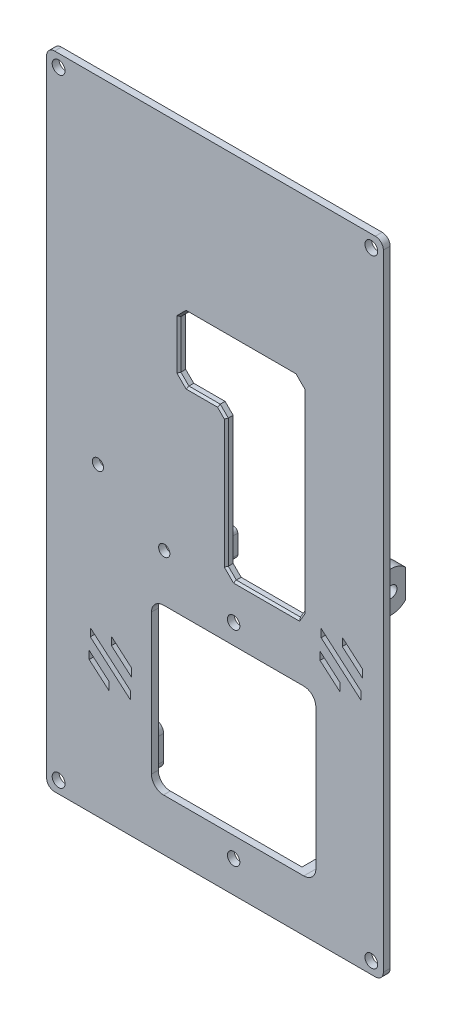
from build123d import *

# Parameters (mm, degrees)
SKETCH_1_R          = 1.6
EXTRUDE_2_DEPTH     = 1.7
EXTRUDE_3_DEPTH     = 1.7
EXTRUDE_4_DEPTH     = 1.7
EXTRUDE_5_DEPTH     = 5.5
SKETCH_7_W          = 10.585667863
SKETCH_7_H          = 36.726600393
EXTRUDE_7_DEPTH     = 1.7
CHAMFER_1_SIZE      = 2
SKETCH_8_R          = 1.4
CUT_EXTRUDE_2_DEPTH = 1.7
EXTRUDE_8_DEPTH     = 2
CUT_EXTRUDE_3_DEPTH = 1.7
SKETCH_11_R         = 1.4
EXTRUDE_9_DEPTH     = 6.5
FILLET_1_R          = 2
SKETCH_12_W         = 3.2
SKETCH_12_H         = 56.377024887
CUT_EXTRUDE_4_DEPTH = 10
FILLET_2_R          = 2
SKETCH_13_R         = 1.55
CUT_EXTRUDE_5_DEPTH = 10
FILLET_3_R          = 3
CUT_EXTRUDE_6_DEPTH = 1.7
EXTRUDE_10_DEPTH    = 1.7
CUT_EXTRUDE_7_DEPTH = 10
CHAMFER_2_SIZE      = 0.5
EXTRUDE_START       = -1.7
SKETCH_17_R         = 1.6
EXTRUDE_11_DEPTH    = 1.7
SKETCH_18_W         = 76
SKETCH_18_H         = 26.241599538
SKETCH_18_H_2       = 29.427514862
CUT_EXTRUDE_8_DEPTH = 1.7
EXTRUDE_12_DEPTH    = 1.7
SKETCH_20_R         = 1.6
CUT_EXTRUDE_9_DEPTH = 1.7
FILLET_4_R          = 2


with BuildPart() as part:
    # 草图1 → 凸台-拉伸2 (new body)
    with BuildSketch(Plane.XY):
        with BuildLine():
            Line((-237.109838541, 1489.364517141), (-241.33992148, 1480.904351264))
            ThreePointArc((-241.33992148, 1480.904351264), (-241.6014133, 1480.507591558), (-241.949123299, 1480.183718137))
            Line((-241.949123299, 1480.183718137), (-254.721014879, 1470.855029631))
            ThreePointArc((-254.721014879, 1470.855029631), (-255.280232366, 1470.568758753), (-255.900667441, 1470.47008995))
            Line((-255.900667441, 1470.47008995), (-262.702950171, 1470.47008995))
            ThreePointArc((-262.702950171, 1470.47008995), (-265.531377295, 1469.298517074), (-266.702950171, 1466.47008995))
            Line((-266.702950171, 1466.47008995), (-266.702950171, 1318.47008995))
            ThreePointArc((-266.702950171, 1318.47008995), (-265.531377295, 1315.641662825), (-262.702950171, 1314.47008995))
            Line((-262.702950171, 1314.47008995), (-255.900667441, 1314.47008995))
            ThreePointArc((-255.900667441, 1314.47008995), (-255.280232366, 1314.371421146), (-254.721014879, 1314.085150268))
            Line((-254.721014879, 1314.085150268), (-241.949123299, 1304.756461763))
            ThreePointArc((-241.949123299, 1304.756461763), (-241.6014133, 1304.432588342), (-241.33992148, 1304.035828635))
            Line((-241.33992148, 1304.035828635), (-237.109838541, 1295.575662759))
            ThreePointArc((-237.109838541, 1295.575662759), (-236.372446384, 1294.768788333), (-235.320984159, 1294.47008995))
            Line((-235.320984159, 1294.47008995), (-214.084916182, 1294.47008995))
            ThreePointArc((-214.084916182, 1294.47008995), (-213.033453958, 1294.768788333), (-212.2960618, 1295.575662759))
            Line((-212.2960618, 1295.575662759), (-208.065978862, 1304.035828635))
            ThreePointArc((-208.065978862, 1304.035828635), (-207.804487042, 1304.432588342), (-207.456777042, 1304.756461763))
            Line((-207.456777042, 1304.756461763), (-194.684885463, 1314.085150268))
            ThreePointArc((-194.684885463, 1314.085150268), (-194.125667975, 1314.371421146), (-193.5052329, 1314.47008995))
            Line((-193.5052329, 1314.47008995), (-186.702950171, 1314.47008995))
            ThreePointArc((-186.702950171, 1314.47008995), (-183.874523046, 1315.641662825), (-182.702950171, 1318.47008995))
            Line((-182.702950171, 1318.47008995), (-182.702950171, 1466.47008995))
            ThreePointArc((-182.702950171, 1466.47008995), (-183.874523046, 1469.298517074), (-186.702950171, 1470.47008995))
            Line((-186.702950171, 1470.47008995), (-193.5052329, 1470.47008995))
            ThreePointArc((-193.5052329, 1470.47008995), (-194.125667975, 1470.568758753), (-194.684885463, 1470.855029631))
            Line((-194.684885463, 1470.855029631), (-207.456777042, 1480.183718137))
            ThreePointArc((-207.456777042, 1480.183718137), (-207.804487042, 1480.507591558), (-208.065978862, 1480.904351264))
            Line((-208.065978862, 1480.904351264), (-212.2960618, 1489.364517141))
            ThreePointArc((-212.2960618, 1489.364517141), (-213.033453958, 1490.171391566), (-214.084916182, 1490.47008995))
            Line((-214.084916182, 1490.47008995), (-235.320984159, 1490.47008995))
            ThreePointArc((-235.320984159, 1490.47008995), (-236.372446384, 1490.171391566), (-237.109838541, 1489.364517141))
        make_face()
        with Locations((-201.702950171, 1470.97008995)):
            Circle(SKETCH_1_R, mode=Mode.SUBTRACT)
        with Locations((-247.702950171, 1470.97008995)):
            Circle(SKETCH_1_R, mode=Mode.SUBTRACT)
        with Locations((-247.702950171, 1313.97008995)):
            Circle(SKETCH_1_R, mode=Mode.SUBTRACT)
        with Locations((-201.702950171, 1313.97008995)):
            Circle(SKETCH_1_R, mode=Mode.SUBTRACT)
        with BuildLine():
            Line((-203.466882193, 1467.47008995), (-189.702950171, 1467.47008995))
            ThreePointArc((-189.702950171, 1467.47008995), (-186.874523046, 1466.298517074), (-185.702950171, 1463.47008995))
            Line((-185.702950171, 1463.47008995), (-185.702950171, 1321.47008995))
            ThreePointArc((-185.702950171, 1321.47008995), (-186.874523046, 1318.641662825), (-189.702950171, 1317.47008995))
            Line((-189.702950171, 1317.47008995), (-203.466882193, 1317.47008995))
            ThreePointArc((-203.466882193, 1317.47008995), (-204.518344417, 1317.171391566), (-205.255736575, 1316.364517141))
            Line((-205.255736575, 1316.364517141), (-214.150163766, 1298.575662759))
            ThreePointArc((-214.150163766, 1298.575662759), (-214.887555924, 1297.768788333), (-215.939018148, 1297.47008995))
            Line((-215.939018148, 1297.47008995), (-233.466882193, 1297.47008995))
            ThreePointArc((-233.466882193, 1297.47008995), (-234.518344417, 1297.768788333), (-235.255736575, 1298.575662759))
            Line((-235.255736575, 1298.575662759), (-244.150163766, 1316.364517141))
            ThreePointArc((-244.150163766, 1316.364517141), (-244.887555924, 1317.171391566), (-245.939018148, 1317.47008995))
            Line((-245.939018148, 1317.47008995), (-259.702950171, 1317.47008995))
            ThreePointArc((-259.702950171, 1317.47008995), (-262.531377295, 1318.641662825), (-263.702950171, 1321.47008995))
            Line((-263.702950171, 1321.47008995), (-263.702950171, 1463.47008995))
            ThreePointArc((-263.702950171, 1463.47008995), (-262.531377295, 1466.298517074), (-259.702950171, 1467.47008995))
            Line((-259.702950171, 1467.47008995), (-245.939018148, 1467.47008995))
            ThreePointArc((-245.939018148, 1467.47008995), (-244.887555924, 1467.768788333), (-244.150163766, 1468.575662759))
            Line((-244.150163766, 1468.575662759), (-235.255736575, 1486.364517141))
            ThreePointArc((-235.255736575, 1486.364517141), (-234.518344417, 1487.171391566), (-233.466882193, 1487.47008995))
            Line((-233.466882193, 1487.47008995), (-215.939018148, 1487.47008995))
            ThreePointArc((-215.939018148, 1487.47008995), (-214.887555924, 1487.171391566), (-214.150163766, 1486.364517141))
            Line((-214.150163766, 1486.364517141), (-205.255736575, 1468.575662759))
            ThreePointArc((-205.255736575, 1468.575662759), (-204.518344417, 1467.768788333), (-203.466882193, 1467.47008995))
        make_face(mode=Mode.SUBTRACT)
    extrude(amount=EXTRUDE_2_DEPTH)

    # 草图2 → 凸台-拉伸3 (add)
    with BuildSketch(Plane(origin=(0, 0, 0), x_dir=(-1, 0, 0), z_dir=(0, 0, -1))):
        with BuildLine():
            Line((203.466882193, 1467.47008995), (189.702950171, 1467.47008995))
            ThreePointArc((189.702950171, 1467.47008995), (186.874523046, 1466.298517074), (185.702950171, 1463.47008995))
            Line((185.702950171, 1463.47008995), (185.702950171, 1438.47008995))
            Line((185.702950171, 1438.47008995), (263.702950171, 1438.47008995))
            Line((263.702950171, 1438.47008995), (263.702950171, 1463.47008995))
            ThreePointArc((263.702950171, 1463.47008995), (262.531377295, 1466.298517074), (259.702950171, 1467.47008995))
            Line((259.702950171, 1467.47008995), (245.939018148, 1467.47008995))
            ThreePointArc((245.939018148, 1467.47008995), (244.887555924, 1467.768788333), (244.150163766, 1468.575662759))
            Line((244.150163766, 1468.575662759), (235.255736575, 1486.364517141))
            ThreePointArc((235.255736575, 1486.364517141), (234.518344417, 1487.171391566), (233.466882193, 1487.47008995))
            Line((233.466882193, 1487.47008995), (215.939018148, 1487.47008995))
            ThreePointArc((215.939018148, 1487.47008995), (214.887555924, 1487.171391566), (214.150163766, 1486.364517141))
            Line((214.150163766, 1486.364517141), (205.255736575, 1468.575662759))
            ThreePointArc((205.255736575, 1468.575662759), (204.518344417, 1467.768788333), (203.466882193, 1467.47008995))
        make_face()
        with BuildLine():
            Line((185.702950171, 1346.47008995), (185.702950171, 1321.47008995))
            ThreePointArc((185.702950171, 1321.47008995), (186.874523046, 1318.641662825), (189.702950171, 1317.47008995))
            Line((189.702950171, 1317.47008995), (203.466882193, 1317.47008995))
            ThreePointArc((203.466882193, 1317.47008995), (204.518344417, 1317.171391566), (205.255736575, 1316.364517141))
            Line((205.255736575, 1316.364517141), (214.150163766, 1298.575662759))
            ThreePointArc((214.150163766, 1298.575662759), (214.887555924, 1297.768788333), (215.939018148, 1297.47008995))
            Line((215.939018148, 1297.47008995), (233.466882193, 1297.47008995))
            ThreePointArc((233.466882193, 1297.47008995), (234.518344417, 1297.768788333), (235.255736575, 1298.575662759))
            Line((235.255736575, 1298.575662759), (244.150163766, 1316.364517141))
            ThreePointArc((244.150163766, 1316.364517141), (244.887555924, 1317.171391566), (245.939018148, 1317.47008995))
            Line((245.939018148, 1317.47008995), (259.702950171, 1317.47008995))
            ThreePointArc((259.702950171, 1317.47008995), (262.531377295, 1318.641662825), (263.702950171, 1321.47008995))
            Line((263.702950171, 1321.47008995), (263.702950171, 1346.47008995))
            Line((263.702950171, 1346.47008995), (185.702950171, 1346.47008995))
        make_face()
    extrude(amount=-EXTRUDE_3_DEPTH)

    # 草图3 → 凸台-拉伸4 (add)
    with BuildSketch(Plane.XY.offset(1.7)):
        Polygon((-263.702950171, 1346.47008995), (-185.702950171, 1346.47008995), (-185.702950171, 1386.319538295), (-185.702950171, 1438.47008995), (-217.202950171, 1438.47008995), (-217.202950171, 1388.47008995), (-245.702950171, 1388.47008995), (-245.702950171, 1438.47008995), (-263.702950171, 1438.47008995), (-263.702950171, 1386.319538295), align=None)
    extrude(amount=-EXTRUDE_4_DEPTH)

    # 草图5 → 凸台-拉伸5 (add)
    with BuildSketch(Plane(origin=(0, 0, 0), x_dir=(-1, 0, 0), z_dir=(0, 0, -1))):
        with BuildLine():
            Line((196.702950171, 1461.47008995), (202.702950171, 1461.47008995))
            ThreePointArc((202.702950171, 1461.47008995), (204.117163733, 1460.884303512), (204.702950171, 1459.47008995))
            Line((204.702950171, 1459.47008995), (204.702950171, 1453.47008995))
            ThreePointArc((204.702950171, 1453.47008995), (204.117163733, 1452.055876387), (202.702950171, 1451.47008995))
            Line((202.702950171, 1451.47008995), (196.702950171, 1451.47008995))
            ThreePointArc((196.702950171, 1451.47008995), (195.288736608, 1452.055876387), (194.702950171, 1453.47008995))
            Line((194.702950171, 1453.47008995), (194.702950171, 1459.47008995))
            ThreePointArc((194.702950171, 1459.47008995), (195.288736608, 1460.884303512), (196.702950171, 1461.47008995))
        make_face()
        with BuildLine():
            Line((204.702950171, 1325.47008995), (204.702950171, 1331.47008995))
            ThreePointArc((204.702950171, 1331.47008995), (204.117163733, 1332.884303512), (202.702950171, 1333.47008995))
            Line((202.702950171, 1333.47008995), (196.702950171, 1333.47008995))
            ThreePointArc((196.702950171, 1333.47008995), (195.288736608, 1332.884303512), (194.702950171, 1331.47008995))
            Line((194.702950171, 1331.47008995), (194.702950171, 1325.47008995))
            ThreePointArc((194.702950171, 1325.47008995), (195.288736608, 1324.055876387), (196.702950171, 1323.47008995))
            Line((196.702950171, 1323.47008995), (202.702950171, 1323.47008995))
            ThreePointArc((202.702950171, 1323.47008995), (204.117163733, 1324.055876387), (204.702950171, 1325.47008995))
        make_face()
        with BuildLine():
            Line((252.702950171, 1323.47008995), (246.702950171, 1323.47008995))
            ThreePointArc((246.702950171, 1323.47008995), (245.288736608, 1324.055876387), (244.702950171, 1325.47008995))
            Line((244.702950171, 1325.47008995), (244.702950171, 1331.47008995))
            ThreePointArc((244.702950171, 1331.47008995), (245.288736608, 1332.884303512), (246.702950171, 1333.47008995))
            Line((246.702950171, 1333.47008995), (252.702950171, 1333.47008995))
            ThreePointArc((252.702950171, 1333.47008995), (254.117163733, 1332.884303512), (254.702950171, 1331.47008995))
            Line((254.702950171, 1331.47008995), (254.702950171, 1325.47008995))
            ThreePointArc((254.702950171, 1325.47008995), (254.117163733, 1324.055876387), (252.702950171, 1323.47008995))
        make_face()
        with BuildLine():
            Line((244.702950171, 1459.47008995), (244.702950171, 1453.47008995))
            ThreePointArc((244.702950171, 1453.47008995), (245.288736608, 1452.055876387), (246.702950171, 1451.47008995))
            Line((246.702950171, 1451.47008995), (252.702950171, 1451.47008995))
            ThreePointArc((252.702950171, 1451.47008995), (254.117163733, 1452.055876387), (254.702950171, 1453.47008995))
            Line((254.702950171, 1453.47008995), (254.702950171, 1459.47008995))
            ThreePointArc((254.702950171, 1459.47008995), (254.117163733, 1460.884303512), (252.702950171, 1461.47008995))
            Line((252.702950171, 1461.47008995), (246.702950171, 1461.47008995))
            ThreePointArc((246.702950171, 1461.47008995), (245.288736608, 1460.884303512), (244.702950171, 1459.47008995))
        make_face()
    extrude(amount=EXTRUDE_5_DEPTH)

    # 草图7 → 凸台-拉伸7 (add)
    with BuildSketch(Plane.XY.offset(1.7)):
        with Locations((-222.495784103, 1420.106789753)):
            Rectangle(SKETCH_7_W, SKETCH_7_H)
    extrude(amount=-EXTRUDE_7_DEPTH)

    # 倒角1
    chamfer_1_edges = [part.edges().sort_by_distance(p)[0] for p in [
        (-245.702950171, 1438.47008995, 0.85),
        (-245.702950171, 1388.47008995, 0.85),
        (-217.202950171, 1388.47008995, 0.85),
        (-227.788618034, 1401.743489557, 0.85),
        (-227.788618034, 1438.47008995, 0.85),
    ]]
    chamfer(chamfer_1_edges, length=CHAMFER_1_SIZE)

    # 草图8 → 切除-拉伸2 (cut)
    with BuildSketch(Plane.XY.offset(1.7)):
        with Locations((-237.356655967, 1378.245710707)):
            Circle(SKETCH_8_R)
        with Locations((-253.893593842, 1388.579136359)):
            Circle(SKETCH_8_R)
    extrude(amount=-CUT_EXTRUDE_2_DEPTH, mode=Mode.SUBTRACT)

    # 草图9 → 凸台-拉伸8 (add)
    with BuildSketch(Plane(origin=(0, 0, 0), x_dir=(-1, 0, 0), z_dir=(0, 0, -1))):
        with BuildLine():
            Line((245.702950171, 1395.297880345), (247.702950171, 1395.297880345))
            ThreePointArc((247.702950171, 1395.297880345), (248.410056952, 1395.004987126), (248.702950171, 1394.297880345))
            Line((248.702950171, 1394.297880345), (248.702950171, 1385.875230614))
            ThreePointArc((248.702950171, 1385.875230614), (248.568975574, 1385.375230614), (248.202950171, 1385.00920521))
            Line((248.202950171, 1385.00920521), (242.935000978, 1381.967753326))
            ThreePointArc((242.935000978, 1381.967753326), (242.693820023, 1381.867852903), (242.435000978, 1381.83377873))
            Line((242.435000978, 1381.83377873), (223.702950171, 1381.83377873))
            ThreePointArc((223.702950171, 1381.83377873), (222.995843389, 1382.126671949), (222.702950171, 1382.83377873))
            Line((222.702950171, 1382.83377873), (222.702950171, 1387.47008995))
            ThreePointArc((222.702950171, 1387.47008995), (222.995843389, 1388.177196731), (223.702950171, 1388.47008995))
            Line((223.702950171, 1388.47008995), (243.702950171, 1388.47008995))
            Line((243.702950171, 1388.47008995), (245.702950171, 1390.47008995))
            Line((245.702950171, 1390.47008995), (245.702950171, 1395.297880345))
        make_face()
    extrude(amount=EXTRUDE_8_DEPTH)

    # 草图10 → 切除-拉伸3 (cut)
    with BuildSketch(Plane.XY.offset(1.7)):
        with BuildLine():
            Line((-228.702950171, 1332.47008995), (-220.702950171, 1332.47008995))
            ThreePointArc((-220.702950171, 1332.47008995), (-219.995843389, 1332.762983168), (-219.702950171, 1333.47008995))
            Line((-219.702950171, 1333.47008995), (-219.702950171, 1341.47008995))
            ThreePointArc((-219.702950171, 1341.47008995), (-219.995843389, 1342.177196731), (-220.702950171, 1342.47008995))
            Line((-220.702950171, 1342.47008995), (-228.702950171, 1342.47008995))
            ThreePointArc((-228.702950171, 1342.47008995), (-229.410056952, 1342.177196731), (-229.702950171, 1341.47008995))
            Line((-229.702950171, 1341.47008995), (-229.702950171, 1333.47008995))
            ThreePointArc((-229.702950171, 1333.47008995), (-229.410056952, 1332.762983168), (-228.702950171, 1332.47008995))
        make_face()
    extrude(amount=-CUT_EXTRUDE_3_DEPTH, mode=Mode.SUBTRACT)

    # 草图11 → 凸台-拉伸9 (add)
    with BuildSketch(Plane.ZY.offset(266.702950171)):
        with BuildLine():
            Line((-3.5, 1397.47008995), (0, 1397.47008995))
            Line((0, 1397.47008995), (0, 1387.47008995))
            Line((0, 1387.47008995), (-3.5, 1387.47008995))
            ThreePointArc((-3.5, 1387.47008995), (-5.390294809, 1387.841182353), (-7, 1388.899375735))
            Line((-7, 1388.899375735), (-7, 1396.040804164))
            ThreePointArc((-7, 1396.040804164), (-5.390294809, 1397.098997546), (-3.5, 1397.47008995))
        make_face()
        with Locations((-3.5, 1392.47008995)):
            Circle(SKETCH_11_R, mode=Mode.SUBTRACT)
    extrude_9 = extrude(amount=-EXTRUDE_9_DEPTH)

    # 镜向1: 凸台-拉伸9 across plane
    add(extrude_9.mirror(Plane(origin=(-224.702950171, 0, 0), x_dir=(0, 0, 1), z_dir=(1, 0, 0))))

    # 圆角1
    fillet_1_edges = [part.edges().sort_by_distance(p)[0] for p in [
        (-263.452950171, 1397.47008995, 0),
        (-263.452950171, 1387.47008995, 0),
        (-185.952950171, 1387.47008995, 0),
        (-185.952950171, 1397.47008995, 0),
    ]]
    fillet(fillet_1_edges, radius=FILLET_1_R)

    # 草图12 → 切除-拉伸4 (cut)
    with BuildSketch(Plane(origin=(0, 0, 0), x_dir=(-1, 0, 0), z_dir=(0, 0, -1))):
        with Locations((184.302950171, 1393.580715835)):
            Rectangle(SKETCH_12_W, SKETCH_12_H)
        with Locations((265.102950171, 1393.580715835)):
            Rectangle(SKETCH_12_W, SKETCH_12_H)
    extrude(amount=CUT_EXTRUDE_4_DEPTH, mode=Mode.SUBTRACT)

    # 圆角2
    fillet_2_edges = [part.edges().sort_by_distance(p)[0] for p in [
        (-189.202950171, 1392.47008995, 0),
        (-260.202950171, 1392.47008995, 0),
    ]]
    fillet(fillet_2_edges, radius=FILLET_2_R)

    # 草图13 → 切除-拉伸5 (cut)
    with BuildSketch(Plane.XY.offset(1.7)):
        with Locations((-220.046770469, 1320.356360457)):
            Circle(SKETCH_13_R)
        with Locations((-220.046770469, 1371.356360457)):
            Circle(SKETCH_13_R)
        with BuildLine():
            Line((-237.546770469, 1325.356360457), (-202.546770469, 1325.356360457))
            ThreePointArc((-202.546770469, 1325.356360457), (-200.425450126, 1326.235040113), (-199.546770469, 1328.356360457))
            Line((-199.546770469, 1328.356360457), (-199.546770469, 1363.356360457))
            ThreePointArc((-199.546770469, 1363.356360457), (-200.425450126, 1365.4776808), (-202.546770469, 1366.356360457))
            Line((-202.546770469, 1366.356360457), (-237.546770469, 1366.356360457))
            ThreePointArc((-237.546770469, 1366.356360457), (-239.668090813, 1365.4776808), (-240.546770469, 1363.356360457))
            Line((-240.546770469, 1363.356360457), (-240.546770469, 1328.356360457))
            ThreePointArc((-240.546770469, 1328.356360457), (-239.668090813, 1326.235040113), (-237.546770469, 1325.356360457))
        make_face()
    extrude(amount=-CUT_EXTRUDE_5_DEPTH, mode=Mode.SUBTRACT)

    # 圆角3
    # the kernel refuses this fillet: 3 mm, written as the material it takes off along each edge
    with BuildSketch(Plane(origin=(-199.546770469, 1333.47008995, -12.98982973), x_dir=(1, 0, 0), z_dir=(0, 0, 1))) as fillet_3_piece_1:
        with BuildLine():
            CenterArc((3, -2.995931892), FILLET_3_R, 92.984161579, 87.015838421)
            Line((0, -2.995931892), (0, 0))
            Line((0, 0), (2.843820299, 0))
        make_face()
    extrude(amount=12.98982973, mode=Mode.SUBTRACT)

    # 草图14 → 切除-拉伸6 (cut)
    with BuildSketch(Plane.XY.offset(1.7)):
        Polygon((-245.53107859, 1346.812362619), (-245.53107859, 1348.812362619), (-250.53107859, 1353.113306148), (-250.53107859, 1351.113306148), align=None)
        Polygon((-245.810503652, 1341.776472827), (-245.810503652, 1343.776472827), (-255.810503652, 1352.378359884), (-255.810503652, 1350.378359884), align=None)
        Polygon((-251.089928715, 1341.041526564), (-251.089928715, 1343.041526564), (-256.089928715, 1347.342470092), (-256.089928715, 1345.342470092), align=None)
        Polygon((-187.94916251, 1375.413316017), (-187.94916251, 1377.413316017), (-192.94916251, 1381.714259546), (-192.94916251, 1379.714259546), align=None)
        Polygon((-188.228587572, 1370.377426225), (-188.228587572, 1372.377426225), (-198.228587572, 1380.979313283), (-198.228587572, 1378.979313283), align=None)
        Polygon((-193.508012635, 1369.642479962), (-193.508012635, 1371.642479962), (-198.508012635, 1375.943423491), (-198.508012635, 1373.943423491), align=None)
    extrude(amount=-CUT_EXTRUDE_6_DEPTH, mode=Mode.SUBTRACT)

    # 草图16 → 凸台-拉伸10 (add)
    with BuildSketch(Plane.XY.offset(1.7)):
        Polygon((-229.788618034, 1438.47008995), (-227.788618034, 1436.47008995), (-227.788618034, 1403.743489557), (-225.788618034, 1401.743489557), (-217.202950171, 1401.743489557), (-217.202950171, 1390.47008995), (-219.202950171, 1388.47008995), (-243.702950171, 1388.47008995), (-245.702950171, 1390.47008995), (-245.702950171, 1436.47008995), (-243.702950171, 1438.47008995), align=None)
    extrude(amount=-EXTRUDE_10_DEPTH)

    # 草图15 → 切除-拉伸7 (cut)
    with BuildSketch(Plane(origin=(0, 0, 0), x_dir=(-1, 0, 0), z_dir=(0, 0, -1))):
        Polygon((202.702950171, 1430.356360457), (204.702950171, 1432.356360457), (222.702950171, 1432.356360457), (231.702950171, 1432.356360457), (233.702950171, 1430.356360457), (233.702950171, 1418.356360457), (231.702950171, 1416.356360457), (223.874899311, 1416.356360457), (221.874899311, 1414.356360457), (221.874899311, 1382.356360457), (219.874899311, 1380.356360457), (203.874899311, 1380.356360457), (202.702950171, 1382.356360457), align=None)
    extrude(amount=-CUT_EXTRUDE_7_DEPTH, mode=Mode.SUBTRACT)

    # 倒角2
    chamfer_2_edges = [part.edges().sort_by_distance(p)[0] for p in [
        (-218.202950171, 1432.356360457, 1.7),
        (-203.702950171, 1431.356360457, 1.7),
        (-202.702950171, 1406.356360457, 1.7),
        (-203.288924741, 1381.356360457, 1.7),
        (-211.874899311, 1380.356360457, 1.7),
        (-220.874899311, 1381.356360457, 1.7),
        (-221.874899311, 1398.356360457, 1.7),
        (-222.874899311, 1415.356360457, 1.7),
        (-227.788924741, 1416.356360457, 1.7),
        (-232.702950171, 1417.356360457, 1.7),
        (-233.702950171, 1424.356360457, 1.7),
        (-232.702950171, 1431.356360457, 1.7),
    ]]
    chamfer(chamfer_2_edges, length=CHAMFER_2_SIZE)

    # 草图17 → 凸台-拉伸11 (add)
    with BuildSketch(Plane.XY.offset(1.7).offset(EXTRUDE_START)):
        with Locations((-247.702950171, 1470.97008995)):
            Circle(SKETCH_17_R)
        with Locations((-201.702950171, 1470.97008995)):
            Circle(SKETCH_17_R)
        with Locations((-201.702950171, 1313.97008995)):
            Circle(SKETCH_17_R)
        with Locations((-247.702950171, 1313.97008995)):
            Circle(SKETCH_17_R)
    extrude(amount=EXTRUDE_11_DEPTH)

    # 草图18 → 切除-拉伸8 (cut)
    with BuildSketch(Plane.XY.offset(1.7)):
        with Locations((-224.702950171, 1301.349290181)):
            Rectangle(SKETCH_18_W, SKETCH_18_H)
        with Locations((-224.702950171, 1485.183847381)):
            Rectangle(SKETCH_18_W, SKETCH_18_H_2)
    extrude(amount=-CUT_EXTRUDE_8_DEPTH, mode=Mode.SUBTRACT)

    # 草图19 → 凸台-拉伸12 (add)
    with BuildSketch(Plane.XY.offset(1.7)):
        Polygon((-266.702950171, 1326.320323359), (-266.702950171, 1312.47008995), (-182.702950171, 1312.47008995), (-182.702950171, 1327.630219727), (-189.253879708, 1327.630219727), (-189.253879708, 1314.47008995), (-260.152020633, 1314.47008995), (-260.152020633, 1326.320323359), align=None)
        Polygon((-260.152020633, 1470.47008995), (-260.152020633, 1458.619856541), (-266.702950171, 1458.619856541), (-266.702950171, 1472.47008995), (-182.702950171, 1472.47008995), (-182.702950171, 1457.309960172), (-189.253879708, 1457.309960172), (-189.253879708, 1470.47008995), align=None)
    extrude(amount=-EXTRUDE_12_DEPTH)

    # 草图20 → 切除-拉伸9 (cut)
    with BuildSketch(Plane.XY.offset(1.7)):
        with Locations((-263.702950171, 1315.47008995)):
            Circle(SKETCH_20_R)
        with Locations((-263.702950171, 1469.47008995)):
            Circle(SKETCH_20_R)
        with Locations((-185.702950171, 1315.47008995)):
            Circle(SKETCH_20_R)
        with Locations((-185.702950171, 1469.47008995)):
            Circle(SKETCH_20_R)
    extrude(amount=-CUT_EXTRUDE_9_DEPTH, mode=Mode.SUBTRACT)

    # 圆角4
    fillet_4_edges = [part.edges().sort_by_distance(p)[0] for p in [
        (-182.702950171, 1312.47008995, 0.85),
        (-266.702950171, 1312.47008995, 0.85),
        (-266.702950171, 1472.47008995, 0.85),
        (-182.702950171, 1472.47008995, 0.85),
    ]]
    fillet(fillet_4_edges, radius=FILLET_4_R)


solid = part.part
